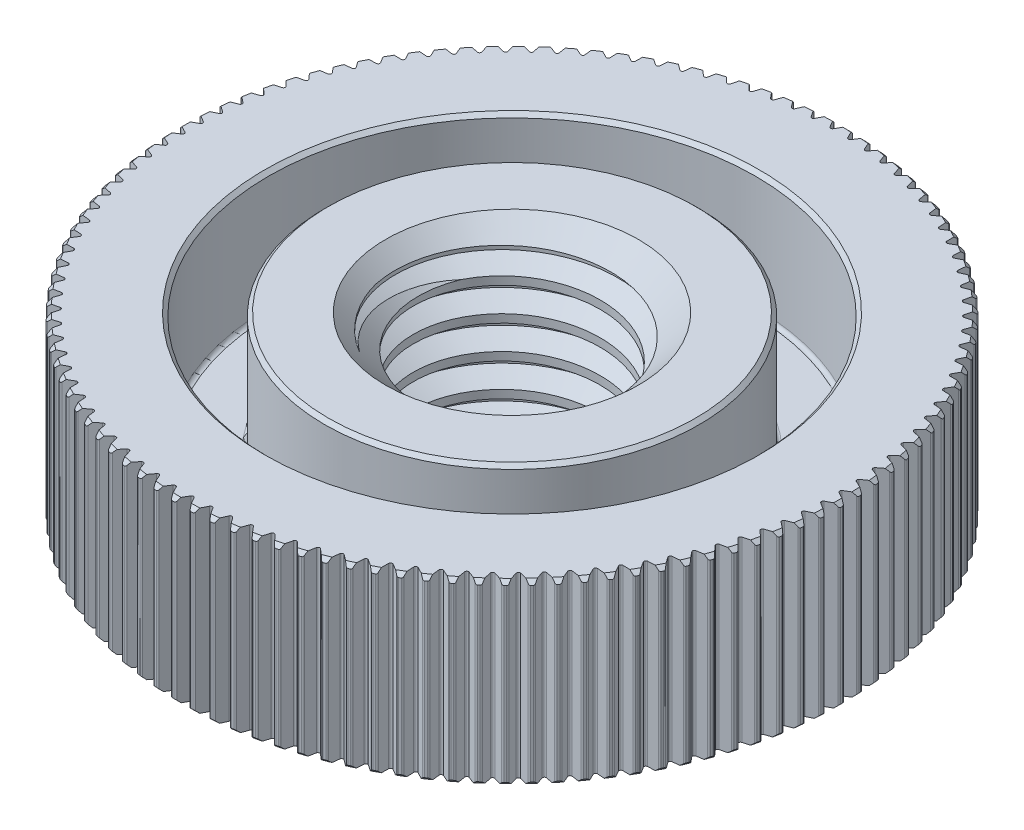
from build123d import *

# Parameters (mm, degrees)
PROFILE_SKETCH_R       = 17.6
PROFILE_SKETCH_R_2     = 5
BODY_DEPTH             = 9.5
CUT_OUT_SKETCH_R       = 13
CUT_OUT_SKETCH_R_2     = 10
CUT_OUT_DEPTH          = 6.5
PRODUCTION_FILLET_R    = 0.2
AESTHETIC_CHAMFER_SIZE = 0.2
THREAD_IN_CHAMFER_SIZE = 1.75
TOOTH_CUT_DEPTH        = 27.641508966
TOOTH_PATTERN_COUNT    = 110
M12X1_75_PITCH         = 1.75


with BuildPart() as part:
    # Profile Sketch → Body (new body)
    with BuildSketch(Plane(origin=(0, 0, 0), x_dir=(1, 0, 0), z_dir=(0, 1, 0))):
        with Locations(Location((0, 0, 0), (0, 0, 270))):
            Circle(PROFILE_SKETCH_R)
        with Locations(Location((0, 0, 0), (0, 0, 270))):
            Circle(PROFILE_SKETCH_R_2, mode=Mode.SUBTRACT)
    extrude(amount=-BODY_DEPTH)

    # Cut Out Sketch → Cut Out (cut)
    with BuildSketch(Plane(origin=(0, 0, 0), x_dir=(1, 0, 0), z_dir=(0, 1, 0))):
        with Locations(Location((0, 0, 0), (0, 0, 270))):
            Circle(CUT_OUT_SKETCH_R)
        with Locations(Location((0, 0, 0), (0, 0, 270))):
            Circle(CUT_OUT_SKETCH_R_2, mode=Mode.SUBTRACT)
    extrude(amount=-CUT_OUT_DEPTH, mode=Mode.SUBTRACT)

    # Production Fillet
    production_fillet_edges = [part.edges().sort_by_distance(p)[0] for p in [
        (0, -6.5, -13),
        (0, -6.5, -10),
    ]]
    fillet(production_fillet_edges, radius=PRODUCTION_FILLET_R)

    # Aesthetic Chamfer
    aesthetic_chamfer_edges = [part.edges().sort_by_distance(p)[0] for p in [
        (0, 0, -13),
        (0, 0, -10),
        (0, 0, -17.6),
        (0, -9.5, -17.6),
        (0, -9.5, -5),
    ]]
    chamfer(aesthetic_chamfer_edges, length=AESTHETIC_CHAMFER_SIZE)

    # Thread In Chamfer
    thread_in_chamfer_edges = [part.edges().sort_by_distance(p)[0] for p in [
        (0, 0, -5),
    ]]
    chamfer(thread_in_chamfer_edges, length=THREAD_IN_CHAMFER_SIZE)

    # Tooth Profile → Tooth Cut (cut, through all)
    with BuildSketch(Plane(origin=(0, 0, 0), x_dir=(1, 0, 0), z_dir=(0, 1, 0))):
        with BuildLine():
            Line((-0.360840641, 17.544278911), (-0.08660254, 17.069284586))
            ThreePointArc((-0.08660254, 17.069284586), (0, 17.019284586), (0.08660254, 17.069284586))
            Line((0.08660254, 17.069284586), (0.360840641, 17.544278911))
            ThreePointArc((0.360840641, 17.544278911), (0.398554494, 17.581513629), (0.45, 17.594246219))
            Line((0.45, 17.594246219), (0.45, 17.894246219))
            Line((0.45, 17.894246219), (-0.45, 17.894246219))
            Line((-0.45, 17.894246219), (-0.45, 17.594246219))
            ThreePointArc((-0.45, 17.594246219), (-0.398554494, 17.581513629), (-0.360840641, 17.544278911))
        make_face()
    tooth_cut = extrude(amount=-TOOTH_CUT_DEPTH, mode=Mode.SUBTRACT)

    # Tooth Pattern: Tooth Cut ×110 about axis
    tooth_pattern_axis = Axis((0, 0, 0), (0, 1, 0))
    for i in range(1, TOOTH_PATTERN_COUNT):
        add(tooth_cut.rotate(tooth_pattern_axis, i * 360 / TOOTH_PATTERN_COUNT), mode=Mode.SUBTRACT)

    # M12x1.75: the profile of Thread Profile1 profile screwed along a right-hand helix of 6.857143 turns, 10 arcs to a turn; built about Z, then put on its axis
    m12x1_75_z = Axis((0, 0, 0), (0, 0, 1))
    m12x1_75_corners = [(4.9997, 3e-09, -0.000173205), (5.947215281, 3e-09, 0.546874998), (5.947215281, 3e-09, 0.765624998), (4.9997, 3e-09, 1.3126732)]
    with BuildLine(mode=Mode.PRIVATE) as m12x1_75_profile:
        Line(m12x1_75_corners[0], m12x1_75_corners[1])
        Line(m12x1_75_corners[1], m12x1_75_corners[2])
        Line(m12x1_75_corners[2], m12x1_75_corners[3])
        Line(m12x1_75_corners[3], m12x1_75_corners[0])
    m12x1_75_cap = Face(m12x1_75_profile.wire())
    m12x1_75_turn_angles = [0, 18, 36, 54, 72, 90, 108, 126, 144, 162, 180, 198, 216, 234, 252, 270, 288, 306, 324, 342, 360]
    m12x1_75_turn_weights = [1, 0.9510565162951535, 1, 0.9510565162951535, 1, 0.9510565162951535, 1, 0.9510565162951535, 1, 0.9510565162951535, 1, 0.9510565162951535, 1, 0.9510565162951535, 1, 0.9510565162951535, 1, 0.9510565162951535, 1, 0.9510565162951535, 1]
    m12x1_75_turn_rails = [Edge.make_bspline([Vector(p[0], p[1], 0).rotate(m12x1_75_z, m12x1_75_turn_angles[k]) / m12x1_75_turn_weights[k] + Vector(0, 0, p[2] + M12X1_75_PITCH * m12x1_75_turn_angles[k] / 360) for k in range(21)], [0, 0, 0, 1, 1, 2, 2, 3, 3, 4, 4, 5, 5, 6, 6, 7, 7, 8, 8, 9, 9, 10, 10, 10], 2, m12x1_75_turn_weights) for p in m12x1_75_corners]
    m12x1_75_turn_sides = [Face.make_surface_from_curves(m12x1_75_turn_rails[p[0]], m12x1_75_turn_rails[p[1]]) for p in [(0, 1), (1, 2), (2, 3), (3, 0)]]
    m12x1_75_last_angles = [2160, 2178, 2196, 2214, 2232, 2250, 2268, 2286, 2304, 2322, 2340, 2358, 2376, 2394, 2412, 2430, 2448, 2458.285714286, 2468.571428571]
    m12x1_75_last_weights = [1, 0.9510565162951535, 1, 0.9510565162951535, 1, 0.9510565162951535, 1, 0.9510565162951535, 1, 0.9510565162951535, 1, 0.9510565162951535, 1, 0.9510565162951535, 1, 0.9510565162951535, 1, 0.9839295885986299, 1]
    m12x1_75_last_rails = [Edge.make_bspline([Vector(p[0], p[1], 0).rotate(m12x1_75_z, m12x1_75_last_angles[k]) / m12x1_75_last_weights[k] + Vector(0, 0, p[2] + M12X1_75_PITCH * m12x1_75_last_angles[k] / 360) for k in range(19)], [0, 0, 0, 1, 1, 2, 2, 3, 3, 4, 4, 5, 5, 6, 6, 7, 7, 8, 8, 9, 9, 9], 2, m12x1_75_last_weights) for p in m12x1_75_corners]
    m12x1_75_last_sides = [Face.make_surface_from_curves(m12x1_75_last_rails[p[0]], m12x1_75_last_rails[p[1]]) for p in [(0, 1), (1, 2), (2, 3), (3, 0)]]
    m12x1_75 = Plane(origin=(0, 1.75, 0), x_dir=(-0.382683432, 0, 0.923879533), z_dir=(0, -1, 0)) * Solid(Shell([*[p.moved(Location((0, 0, M12X1_75_PITCH * i))) for i in range(6) for p in m12x1_75_turn_sides], *m12x1_75_last_sides, m12x1_75_cap, m12x1_75_cap.rotate(m12x1_75_z, 2468.571428571).moved(Location((0, 0, M12X1_75_PITCH * 2468.571428571 / 360)))]))
    add(m12x1_75, mode=Mode.SUBTRACT)


solid = part.part
